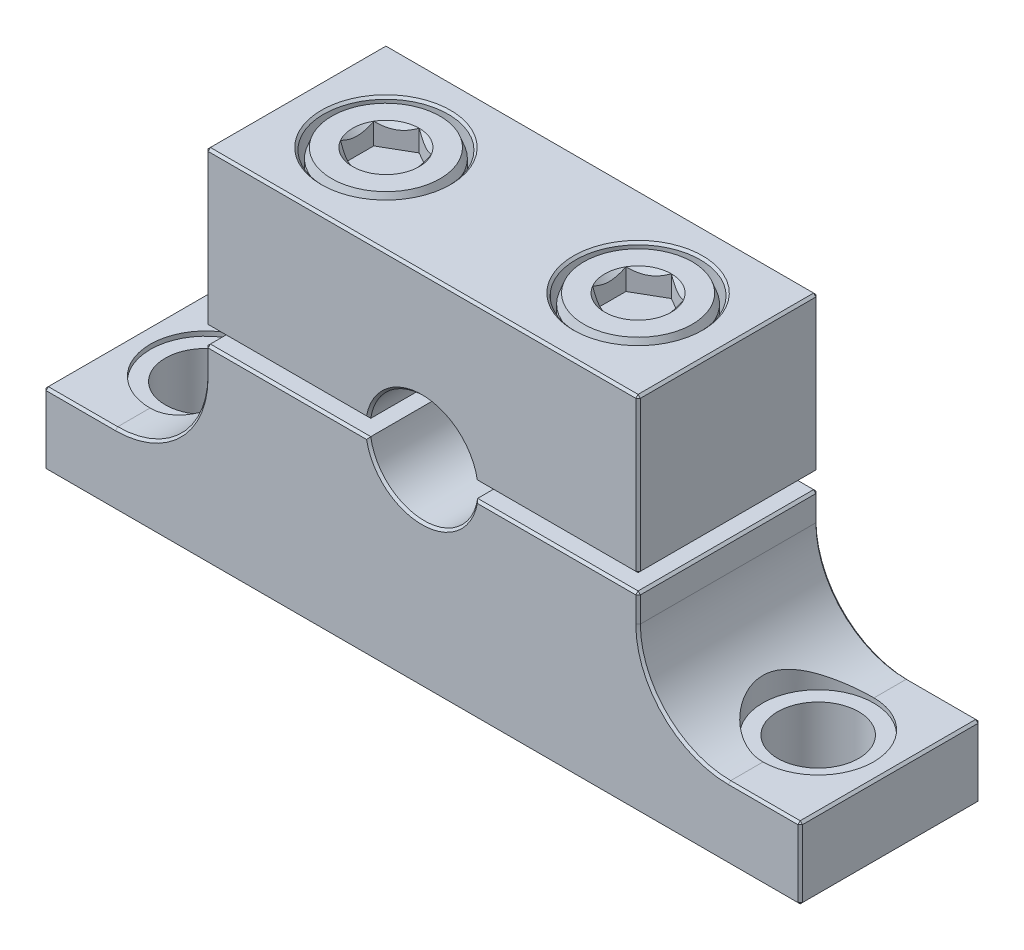
from build123d import *

# Parameters (mm, degrees)
BOSS_EXTRUDE1_DEPTH        = 5
BOSS_EXTRUDE1_DEPTH_BACK   = 5
BOSS_EXTRUDE1_2_DEPTH      = 5
BOSS_EXTRUDE1_2_DEPTH_BACK = 5
SKETCH4_R                  = 2.25
CUT_EXTRUDE1_DEPTH         = 30.427877939
SKETCH8_R                  = 3.081
CUT_EXTRUDE3_DEPTH         = 6.8025
SKETCH10_R                 = 2.254
CUT_EXTRUDE4_DEPTH         = 30.427877956
SKETCH12_R                 = 3.456
CUT_EXTRUDE5_DEPTH         = 3.6198
CHAMFER4_SIZE              = 0.192
CHAMFER4_SIZE2             = 0.527515665
CUT_EXTRUDE6_DEPTH         = 1.189584
SKETCH20_R                 = 1.847520861
CUT_EXTRUDE7_DEPTH         = 1.189584
CUT_EXTRUDE7_DRAFT         = -45
CHAMFER2_SIZE              = 0.127
CHAMFER3_SIZE              = 0.127
CHAMFER5_SIZE              = 0.3
CUT_SWEEP1_PITCH           = 0.7
CUT_SWEEP1_TO              = 8.3952
CIRPATTERN1_COUNT          = 2


with BuildPart() as part:
    # Sketch3 → Boss-Extrude1 (new, two sides: drawn at the far end of the back side and taken through both)
    with BuildSketch(Plane.XY.offset(-BOSS_EXTRUDE1_DEPTH_BACK)):
        with BuildLine():
            Line((-12, 10), (12, 10))
            Line((12, 10), (12, 1.4275))
            Line((12, 1.4275), (2.967632011, 1.4275))
            ThreePointArc((2.967632011, 1.4275), (0, 3.988), (-2.967632011, 1.4275))
            Line((-2.967632011, 1.4275), (-12, 1.4275))
            Line((-12, 1.4275), (-12, 10))
        make_face()
    extrude(amount=BOSS_EXTRUDE1_DEPTH + BOSS_EXTRUDE1_DEPTH_BACK)


with BuildPart() as body_2:
    # Sketch3 → Boss-Extrude1 2 (new, two sides: drawn at the far end of the back side and taken through both)
    with BuildSketch(Plane.XY.offset(-BOSS_EXTRUDE1_2_DEPTH_BACK)):
        with BuildLine():
            Line((-12, 0.5485), (-12, -0.983))
            ThreePointArc((-12, -0.983), (-13.469445279, -4.530554721), (-17.017, -6))
            Line((-17.017, -6), (-21, -6))
            Line((-21, -6), (-21, -10))
            Line((-21, -10), (21, -10))
            Line((21, -10), (21, -6))
            Line((21, -6), (17.017, -6))
            ThreePointArc((17.017, -6), (13.469445279, -4.530554721), (12, -0.983))
            Line((12, -0.983), (12, 0.5485))
            Line((12, 0.5485), (2.967632011, 0.5485))
            ThreePointArc((2.967632011, 0.5485), (0, -2.012), (-2.967632011, 0.5485))
            Line((-2.967632011, 0.5485), (-12, 0.5485))
        make_face()
    extrude(amount=BOSS_EXTRUDE1_2_DEPTH + BOSS_EXTRUDE1_2_DEPTH_BACK)

    # Sketch4 → Cut-Extrude1 (cut, through all)
    with BuildSketch(Plane.XZ.offset(10)):
        with Locations((-17, 0)):
            Circle(SKETCH4_R)
        with Locations(Location((17, 0, 0), (0, 0, 89.567094436))):
            Circle(SKETCH4_R)
    extrude(amount=-CUT_EXTRUDE1_DEPTH, mode=Mode.SUBTRACT)

    # Sketch8 → Cut-Extrude3 (cut)
    with BuildSketch(Plane(origin=(0, 0.5485, 0), x_dir=(1, 0, 0), z_dir=(0, 1, 0))):
        with Locations(Location((-17, 0, 0), (0, 0, 180))):
            Circle(SKETCH8_R)
        with Locations(Location((17, 0, 0), (0, 0, 180))):
            Circle(SKETCH8_R)
    extrude(amount=-CUT_EXTRUDE3_DEPTH, mode=Mode.SUBTRACT)


with BuildPart() as cut_extrude4_tool:
    # Sketch10 → Cut-Extrude4 (new, through all)
    with BuildSketch(Plane(origin=(0, 10, 0), x_dir=(1, 0, 0), z_dir=(0, 1, 0))):
        with Locations(Location((7, 0, 0), (0, 0, 180))):
            Circle(SKETCH10_R)
        with Locations(Location((-7, 0, 0), (0, 0, 180))):
            Circle(SKETCH10_R)
    extrude(amount=-CUT_EXTRUDE4_DEPTH)


with BuildPart() as part_1:
    add(part.part)

    # Cut-Extrude4: cut by cut_extrude4_tool
    add(cut_extrude4_tool.part, mode=Mode.SUBTRACT)

    # Sketch12 → Cut-Extrude5 (cut)
    with BuildSketch(Plane(origin=(0, 10, 0), x_dir=(1, 0, 0), z_dir=(0, 1, 0))):
        with Locations((7, 0)):
            Circle(SKETCH12_R)
        with Locations(Location((-7, 0, 0), (0, 0, 180))):
            Circle(SKETCH12_R)
    extrude(amount=-CUT_EXTRUDE5_DEPTH, mode=Mode.SUBTRACT)

    # Chamfer2
    chamfer2_edges = [part_1.edges().sort_by_distance(p)[0] for p in [
        (0, 3.988, -5),
        (-12, 10, 0),
        (12, 10, 0),
        (12, 1.4275, 0),
        (7.483816005, 1.4275, -5),
        (12, 5.71375, -5),
        (-12, 5.71375, 5),
        (-7.483816005, 1.4275, 5),
        (0, 3.988, 5),
        (7.483816005, 1.4275, 5),
        (12, 5.71375, 5),
        (0, 10, -5),
        (0, 10, 5),
        (-12, 5.71375, -5),
        (3.544, 10, 0),
        (-3.544, 10, 0),
        (-7.483816005, 1.4275, -5),
    ]]
    chamfer(chamfer2_edges, length=CHAMFER2_SIZE)


with BuildPart() as body_2_1:
    add(body_2.part)

    # Cut-Extrude4: cut by cut_extrude4_tool
    add(cut_extrude4_tool.part, mode=Mode.SUBTRACT)

    # Chamfer3
    chamfer3_edges = [body_2_1.edges().sort_by_distance(p)[0] for p in [
        (-13.469445279, -4.530554721, -5),
        (-19.0085, -6, -5),
        (-21, -8, -5),
        (0, -10, -5),
        (12, 0.5485, 0),
        (21, -6, 0),
        (21, -10, 0),
        (-21, -10, 0),
        (-21, -6, 0),
        (-12, 0.5485, 0),
        (21, -8, -5),
        (19.0085, -6, -5),
        (13.469445279, -4.530554721, -5),
        (12, -0.21725, -5),
        (-7.483816005, 0.5485, 5),
        (-12, -0.21725, 5),
        (-13.469445279, -4.530554721, 5),
        (7.483816005, 0.5485, -5),
        (-19.0085, -6, 5),
        (-21, -8, 5),
        (0, -10, 5),
        (21, -8, 5),
        (19.0085, -6, 5),
        (13.469445279, -4.530554721, 5),
        (12, -0.21725, 5),
        (7.483816005, 0.5485, 5),
        (0, -2.012, 5),
        (0, -2.012, -5),
        (-7.483816005, 0.5485, -5),
        (-12, -0.21725, -5),
    ]]
    chamfer(chamfer3_edges, length=CHAMFER3_SIZE)


with BuildPart() as body_3:
    # Sketch15 → Revolve1 (revolve)
    with BuildSketch(Plane.XY, mode=Mode.PRIVATE) as revolve1_sk:
        Polygon((-7, -2), (-7, 10), (-10.2, 10), (-10.2, 6.3952), (-9, 6.3952), (-9, -2), align=None)
    revolve(revolve1_sk.sketch.rotate(Axis((-7, -2, 0), (0, 1, 0)), 270), axis=Axis((-7, -2, 0), (0, 1, 0)))

    # Chamfer4
    chamfer4_edges = [body_3.edges().sort_by_distance(p)[0] for p in [
        (-7, 10, 3.2),
    ]]
    chamfer4_side = [body_3.faces().sort_by_distance(p)[0] for p in [
        (-7, 10, 0),
    ]]
    chamfer(chamfer4_edges, length=CHAMFER4_SIZE, length2=CHAMFER4_SIZE2, reference=chamfer4_side[0])

    # Sketch16 → Cut-Extrude6 (cut)
    with BuildSketch(Plane(origin=(0, 10, 0), x_dir=(1, 0, 0), z_dir=(0, 1, 0))):
        Polygon((-7, 1.847520861), (-8.6, 0.923760431), (-8.6, -0.923760431), (-7, -1.847520861), (-5.4, -0.923760431), (-5.4, 0.923760431), align=None)
    extrude(amount=-CUT_EXTRUDE6_DEPTH, mode=Mode.SUBTRACT)


with BuildPart() as cut_extrude7_tool:
    # Sketch20 → Cut-Extrude7 (with draft: the straight prism first)
    with BuildSketch(Plane(origin=(0, 10, 0), x_dir=(1, 0, 0), z_dir=(0, 1, 0))):
        with Locations((-7, 0)):
            Circle(SKETCH20_R)
    extrude(amount=-CUT_EXTRUDE7_DEPTH)
    # Cut-Extrude7: the draft: its side faces are tilted about the plane it starts from
    cut_extrude7_sides = [cut_extrude7_tool.faces().sort_by_distance(p)[0] for p in [
        (-8.847520861, 9.405208, 0),
    ]]
    draft(cut_extrude7_sides, Plane(origin=(0, 10, 0), x_dir=(1, 0, 0), z_dir=(0, 1, 0)), CUT_EXTRUDE7_DRAFT)


with BuildPart() as body_3_1:
    add(body_3.part)

    # Cut-Extrude7: cut by cut_extrude7_tool
    add(cut_extrude7_tool.part, mode=Mode.SUBTRACT)


with BuildPart() as body_4:
    # Mirror1: mirrored copy
    add(body_3_1.part.mirror(Plane(origin=(0, 0, 0), x_dir=(0, 0, 1), z_dir=(1, 0, 0))))

    # Chamfer5
    chamfer5_edges = [body_4.edges().sort_by_distance(p)[0] for p in [
        (7, -2, 2),
    ]]
    chamfer(chamfer5_edges, length=CHAMFER5_SIZE)


with BuildPart() as body_5:
    # Split1: read off the stored shape, not the designer's step
    # Split1: the piece on the far side of the plane
    add(body_4.part)
    split(bisect_by=Plane(origin=(0, 6.3952, 0), x_dir=(1, 0, 0), z_dir=(0, 1, 0)), keep=Keep.BOTTOM)

    # Cut-Sweep1: arcs per turn and ends read off the stored shape
    # Cut-Sweep1: the profile of Sketch21 screwed along a right-hand helix through 13.993142 turns, 6 arcs to a turn; built about Z, then put on its axis
    cut_sweep1_z = Axis((0, 0, 0), (0, 0, 1))
    cut_sweep1_corners = [(1.545336663, 0, -0.6625), (2.037888611, 0, -0.378125), (2.037888611, 0, -1.034375), (1.545336663, 0, -0.75)]
    with BuildLine(mode=Mode.PRIVATE) as cut_sweep1_profile:
        Line(cut_sweep1_corners[0], cut_sweep1_corners[1])
        Line(cut_sweep1_corners[1], cut_sweep1_corners[2])
        Line(cut_sweep1_corners[2], cut_sweep1_corners[3])
        Line(cut_sweep1_corners[3], cut_sweep1_corners[0])
    cut_sweep1_cap = Face(cut_sweep1_profile.wire())
    cut_sweep1_turn_angles = [0, 30, 60, 90, 120, 150, 180, 210, 240, 270, 300, 330, 360]
    cut_sweep1_turn_weights = [1, 0.8660254037844387, 1, 0.8660254037844387, 1, 0.8660254037844387, 1, 0.8660254037844387, 1, 0.8660254037844387, 1, 0.8660254037844387, 1]
    cut_sweep1_turn_rails = [Edge.make_bspline([Vector(p[0], p[1], 0).rotate(cut_sweep1_z, cut_sweep1_turn_angles[k]) / cut_sweep1_turn_weights[k] + Vector(0, 0, p[2] + CUT_SWEEP1_PITCH * cut_sweep1_turn_angles[k] / 360) for k in range(13)], [0, 0, 0, 1, 1, 2, 2, 3, 3, 4, 4, 5, 5, 6, 6, 6], 2, cut_sweep1_turn_weights) for p in cut_sweep1_corners]
    cut_sweep1_turn_sides = [Face.make_surface_from_curves(cut_sweep1_turn_rails[p[0]], cut_sweep1_turn_rails[p[1]]) for p in [(0, 1), (1, 2), (2, 3), (3, 0)]]
    cut_sweep1_last_angles = [4680, 4710, 4740, 4770, 4800, 4830, 4860, 4890, 4920, 4950, 4980, 5008.7655, 5037.531]
    cut_sweep1_last_weights = [1, 0.8660254037844387, 1, 0.8660254037844387, 1, 0.8660254037844387, 1, 0.8660254037844387, 1, 0.8660254037844387, 1, 0.8765966036436802, 1]
    cut_sweep1_last_rails = [Edge.make_bspline([Vector(p[0], p[1], 0).rotate(cut_sweep1_z, cut_sweep1_last_angles[k]) / cut_sweep1_last_weights[k] + Vector(0, 0, p[2] + CUT_SWEEP1_PITCH * cut_sweep1_last_angles[k] / 360) for k in range(13)], [0, 0, 0, 1, 1, 2, 2, 3, 3, 4, 4, 5, 5, 6, 6, 6], 2, cut_sweep1_last_weights) for p in cut_sweep1_corners]
    cut_sweep1_last_sides = [Face.make_surface_from_curves(cut_sweep1_last_rails[p[0]], cut_sweep1_last_rails[p[1]]) for p in [(0, 1), (1, 2), (2, 3), (3, 0)]]
    cut_sweep1 = Plane(origin=(7, -2, 0), x_dir=(1, 0, 0), z_dir=(0, 1, 0)) * split(Solid(Shell([*[p.moved(Location((0, 0, CUT_SWEEP1_PITCH * i))) for i in range(13) for p in cut_sweep1_turn_sides], *cut_sweep1_last_sides, cut_sweep1_cap, cut_sweep1_cap.rotate(cut_sweep1_z, 5037.531).moved(Location((0, 0, CUT_SWEEP1_PITCH * 5037.531 / 360)))])), bisect_by=Plane.XY.offset(CUT_SWEEP1_TO), keep=Keep.BOTTOM, mode=Mode.PRIVATE)
    add(cut_sweep1, mode=Mode.SUBTRACT)


with BuildPart() as body_4_1:
    add(body_4.part)

    # Split1
    split(bisect_by=Plane(origin=(0, 6.3952, 0), x_dir=(1, 0, 0), z_dir=(0, 1, 0)), keep=Keep.TOP)

    add(body_5.part)  # Boss-Extrude2 merges body 5
    # Boss-Extrude2 cone 1 section (through the dimple's axis) → Boss-Extrude2 (revolve)
    with BuildSketch(Plane(origin=(7, 6.3952, 0), x_dir=(0, 0, 1), z_dir=(1, 0, 0))):
        Polygon((0, 0), (2.075777223, 0), (0, 2.075777223), align=None)
    revolve(axis=Axis((7, 6.3952, 0), (0, -1, 0)))


with BuildPart() as cirpattern1_1:
    # CirPattern1: pattern copy
    add(body_4_1.part.rotate(Axis((0, 10, 0), (0, -1, 0)), 1 * 360 / CIRPATTERN1_COUNT))


solid = Compound([part_1.part, body_2_1.part, body_4_1.part, cirpattern1_1.part])
